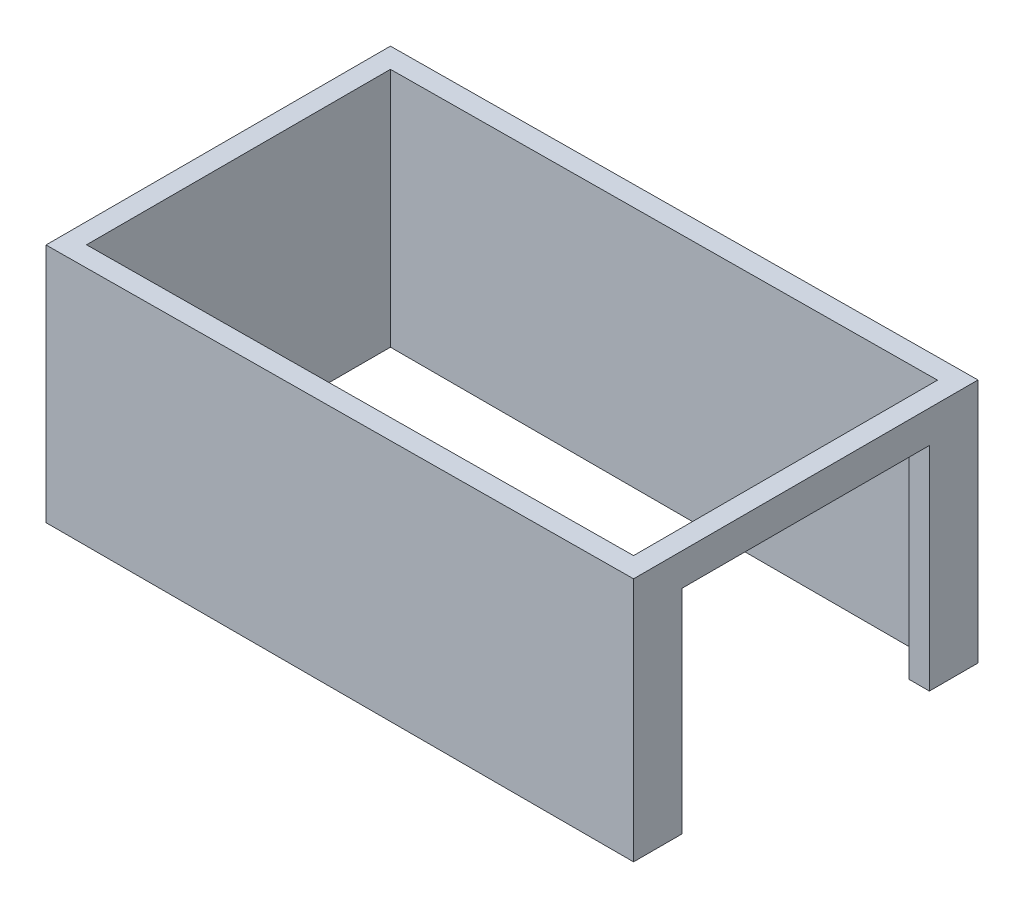
from build123d import *

# Parameters (mm, degrees)
SKETCH_1_W          = 5800
SKETCH_1_H          = 3400
SKETCH_1_W_2        = 5400
SKETCH_1_H_2        = 3000
EXTRUDE_1_DEPTH     = 2420
CUT_EXTRUDE_1_REACH = 7054.404
SKETCH_2_W          = 2440
SKETCH_2_H          = 2100
CUT_EXTRUDE_2_DEPTH = 6985.010309271


with BuildPart() as part:
    # Эскиз1 → Вытянуть-Тонкостенный1 (new body)
    with BuildSketch(Plane(origin=(0, 0, 0), x_dir=(1, 0, 0), z_dir=(0, 1, 0))):
        with Locations((2700, 1500)):
            Rectangle(SKETCH_1_W, SKETCH_1_H)
        with Locations((2700, 1500)):
            Rectangle(SKETCH_1_W_2, SKETCH_1_H_2, mode=Mode.SUBTRACT)
    extrude(amount=EXTRUDE_1_DEPTH)

    # Эскиз2 → Вырез-Вытянуть1 (cut, up to next)
    with BuildSketch(Plane(origin=(5600, 0, 0), x_dir=(0, 0, -1), z_dir=(1, 0, 0)), mode=Mode.PRIVATE) as cut_extrude_1_sk1:
        with Locations((1500, 1050)):
            Rectangle(SKETCH_2_W, SKETCH_2_H)
    cut_extrude_1_tool1 = extrude(cut_extrude_1_sk1.sketch, amount=-CUT_EXTRUDE_1_REACH, mode=Mode.PRIVATE) & part.part
    add(cut_extrude_1_tool1.solids().sort_by_distance((5600, 1050, -1500))[0], mode=Mode.SUBTRACT)

    # Эскиз3 → Вырез-Вытянуть2 (cut, through all)
    with BuildSketch(Plane(origin=(0, 0, -3200), x_dir=(-1, 0, 0), z_dir=(0, 0, -1))):
        Polygon((-5600, 2420), (200, 2420), (200, 2374), align=None)
    extrude(amount=-CUT_EXTRUDE_2_DEPTH, mode=Mode.SUBTRACT)


solid = part.part
